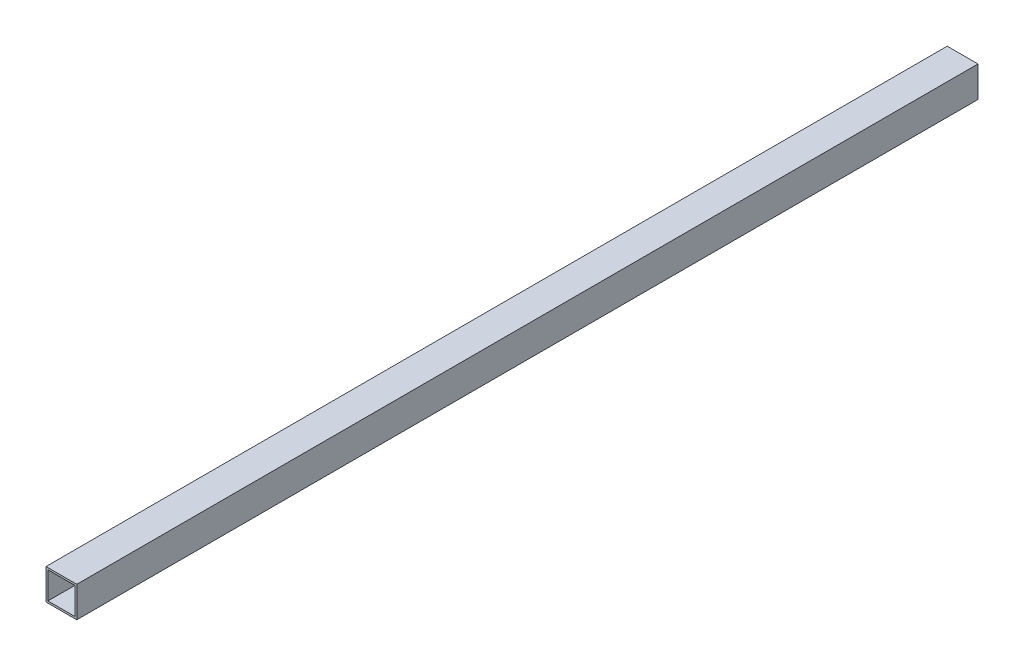
from build123d import *

# Parameters (mm, degrees)
SKETCH1_W           = 25.4
SKETCH1_H           = 25.4
SKETCH1_W_2         = 22.225
SKETCH1_H_2         = 22.225
BOSS_EXTRUDE1_DEPTH = 371.729


with BuildPart() as part:
    # Sketch1 → Boss-Extrude1 (new, symmetric)
    with BuildSketch(Plane.XY):
        Rectangle(SKETCH1_W, SKETCH1_H)
        Rectangle(SKETCH1_W_2, SKETCH1_H_2, mode=Mode.SUBTRACT)
    extrude(amount=BOSS_EXTRUDE1_DEPTH, both=True)


solid = part.part
